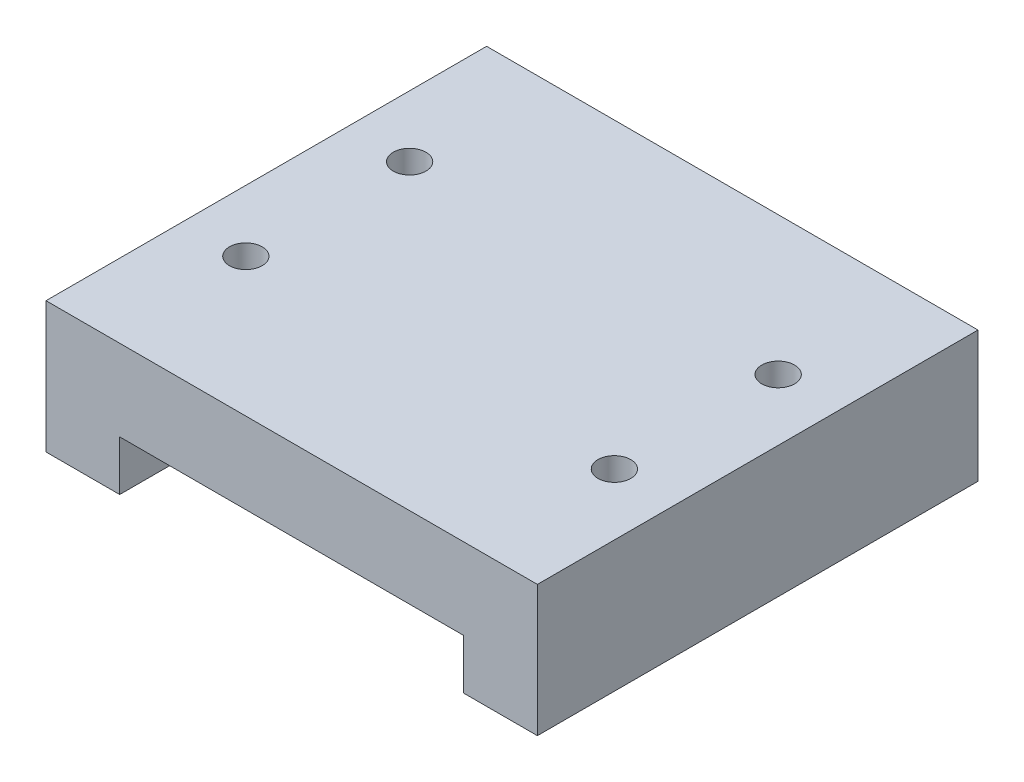
from build123d import *

# Parameters (mm, degrees)
EXTRUDE_1_DEPTH     = 53.8
SKETCH_2_R          = 2
CUT_EXTRUDE_1_DEPTH = 4.2


with BuildPart() as part:
    # 草圖1 → 填料-伸長1 (new body)
    with BuildSketch(Plane.XY):
        Polygon((30, 8), (-30, 8), (-30, -8), (-21, -8), (-21, -1.9), (21, -1.9), (21, -8), (30, -8), align=None)
    extrude(amount=EXTRUDE_1_DEPTH)

    # 草圖2 → 除料-伸長1 (cut)
    with BuildSketch(Plane(origin=(0, 8, 0), x_dir=(1, 0, 0), z_dir=(0, 1, 0))):
        with Locations((-22.5, -16.9)):
            Circle(SKETCH_2_R)
        with Locations((-22.5, -36.9)):
            Circle(SKETCH_2_R)
        with Locations((22.5, -36.9)):
            Circle(SKETCH_2_R)
        with Locations((22.5, -16.9)):
            Circle(SKETCH_2_R)
    extrude(amount=-CUT_EXTRUDE_1_DEPTH, mode=Mode.SUBTRACT)


solid = part.part
